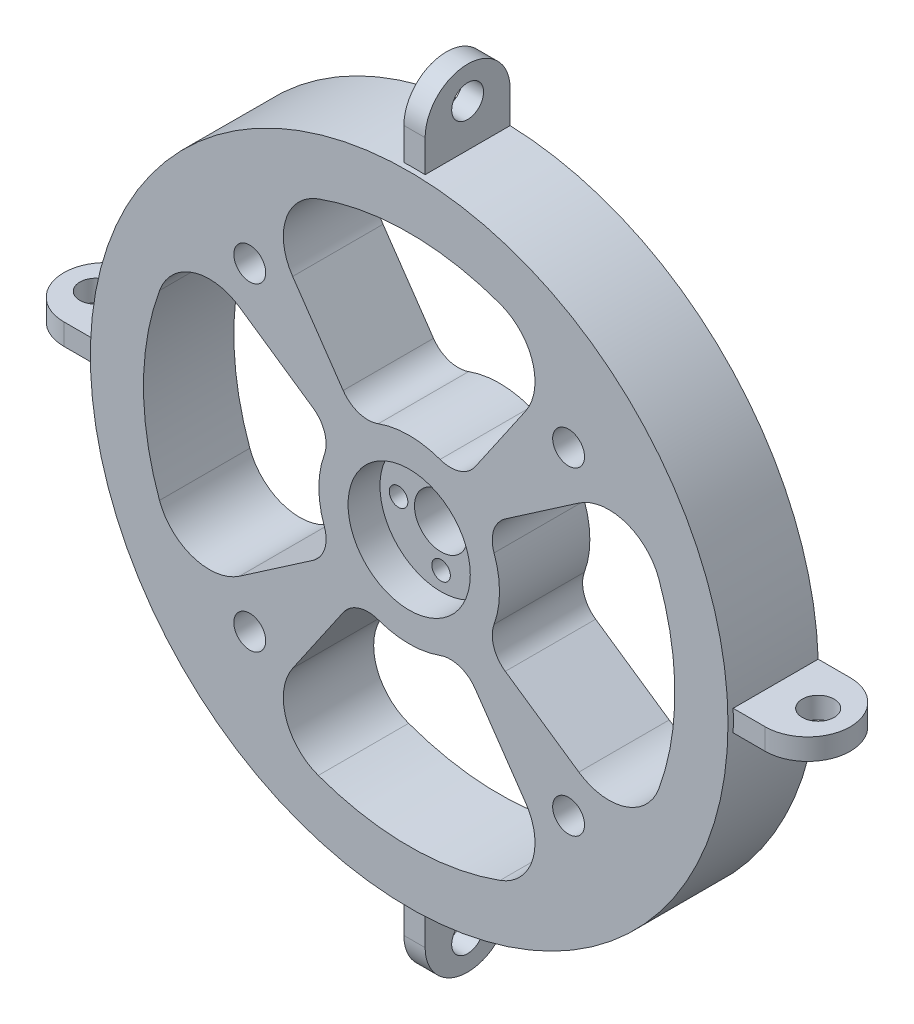
from build123d import *

# Parameters (mm, degrees)
SKETCH_1_R               = 60
EXTRUDE_1_DEPTH          = 17
SKETCH_2_R               = 3
CUT_EXTRUDE_1_DEPTH      = 87.539008545
EXTRUDE_2_DEPTH          = 2
SKETCH_4_R               = 3
CUT_EXTRUDE_7_DEPTH      = 99.025506885
CUT_EXTRUDE_3_REACH      = 98.773
SKETCH_5_R               = 5
SKETCH_6_R               = 11.5
CUT_EXTRUDE_4_DEPTH      = 6
CUT_EXTRUDE_5_REACH      = 97.901
SKETCH_7_R               = 1.75
CUT_EXTRUDE_6_REACH      = 98.773
PATTERN_CIRCULAR_3_COUNT = 4
PATTERN_CIRCULAR_4_COUNT = 4


with BuildPart() as part:
    # 草图1 → 凸台-拉伸1 (new body)
    with BuildSketch(Plane.XY):
        Circle(SKETCH_1_R)
    extrude(amount=EXTRUDE_1_DEPTH)

    # 草图2 → 切除-拉伸1 (cut, through all)
    with BuildSketch(Plane.XY.offset(17)):
        with Locations((-30, 30)):
            Circle(SKETCH_2_R)
        with Locations((30, 30)):
            Circle(SKETCH_2_R)
        with Locations((30, -30)):
            Circle(SKETCH_2_R)
        with Locations((-30, -30)):
            Circle(SKETCH_2_R)
    extrude(amount=-CUT_EXTRUDE_1_DEPTH, mode=Mode.SUBTRACT)

    # 草图3 → 凸台-拉伸2 (add, symmetric)
    with BuildSketch(Plane(origin=(0, 0, 0), x_dir=(0, 0, -1), z_dir=(1, 0, 0))):
        with BuildLine():
            Line((0, 58), (-16, 58))
            Line((-16, 58), (-16, 66))
            ThreePointArc((-16, 66), (-8, 74), (0, 66))
            Line((0, 66), (0, 58))
        make_face()
    extrude_2 = extrude(amount=EXTRUDE_2_DEPTH, both=True)

    # 草图4 → 切除-拉伸7 (cut, through all)
    with BuildSketch(Plane(origin=(2, 0, 0), x_dir=(0, 0, -1), z_dir=(1, 0, 0))):
        with Locations((-8, 67.966657402)):
            Circle(SKETCH_4_R)
    cut_extrude_7 = extrude(amount=-CUT_EXTRUDE_7_DEPTH, mode=Mode.SUBTRACT)

    # 草图5 → 切除-拉伸3 (cut, up to next)
    with BuildSketch(Plane(origin=(0, 0, 0), x_dir=(-1, 0, 0), z_dir=(0, 0, -1)), mode=Mode.PRIVATE) as cut_extrude_3_sk1:
        Circle(SKETCH_5_R)
    cut_extrude_3_tool1 = extrude(cut_extrude_3_sk1.sketch, amount=-CUT_EXTRUDE_3_REACH, mode=Mode.PRIVATE) & part.part
    add(cut_extrude_3_tool1.solids().sort_by_distance((0, 0, 0))[0], mode=Mode.SUBTRACT)

    # 草图6 → 切除-拉伸4 (cut)
    with BuildSketch(Plane.XY.offset(17)):
        Circle(SKETCH_6_R)
    extrude(amount=-CUT_EXTRUDE_4_DEPTH, mode=Mode.SUBTRACT)

    # 草图7 → 切除-拉伸5 (cut, up to next)
    with BuildSketch(Plane.XY.offset(11), mode=Mode.PRIVATE) as cut_extrude_5_sk1:
        with Locations((-8, 0)):
            Circle(SKETCH_7_R)
    cut_extrude_5_tool1 = extrude(cut_extrude_5_sk1.sketch, amount=-CUT_EXTRUDE_5_REACH, mode=Mode.PRIVATE) & part.part
    # 草图7 → 切除-拉伸5 (cut, up to next)
    with BuildSketch(Plane.XY.offset(11), mode=Mode.PRIVATE) as cut_extrude_5_sk2:
        with Locations((0, 8)):
            Circle(SKETCH_7_R)
    cut_extrude_5_tool2 = extrude(cut_extrude_5_sk2.sketch, amount=-CUT_EXTRUDE_5_REACH, mode=Mode.PRIVATE) & part.part
    # 草图7 → 切除-拉伸5 (cut, up to next)
    with BuildSketch(Plane.XY.offset(11), mode=Mode.PRIVATE) as cut_extrude_5_sk3:
        with Locations((8, 0)):
            Circle(SKETCH_7_R)
    cut_extrude_5_tool3 = extrude(cut_extrude_5_sk3.sketch, amount=-CUT_EXTRUDE_5_REACH, mode=Mode.PRIVATE) & part.part
    # 草图7 → 切除-拉伸5 (cut, up to next)
    with BuildSketch(Plane.XY.offset(11), mode=Mode.PRIVATE) as cut_extrude_5_sk4:
        with Locations((0, -8)):
            Circle(SKETCH_7_R)
    cut_extrude_5_tool4 = extrude(cut_extrude_5_sk4.sketch, amount=-CUT_EXTRUDE_5_REACH, mode=Mode.PRIVATE) & part.part
    add(cut_extrude_5_tool1.solids().sort_by_distance((-8, 0, 11))[0], mode=Mode.SUBTRACT)
    add(cut_extrude_5_tool2.solids().sort_by_distance((0, 8, 11))[0], mode=Mode.SUBTRACT)
    add(cut_extrude_5_tool3.solids().sort_by_distance((8, 0, 11))[0], mode=Mode.SUBTRACT)
    add(cut_extrude_5_tool4.solids().sort_by_distance((0, -8, 11))[0], mode=Mode.SUBTRACT)

    # 草图8 → 切除-拉伸6 (cut, up to next)
    with BuildSketch(Plane.XY.offset(17), mode=Mode.PRIVATE) as cut_extrude_6_sk1:
        with BuildLine():
            Line((-18.09189724, 12.423764363), (-31.926877482, 21.924290052))
            ThreePointArc((-31.926877482, 21.924290052), (-40.638216775, 23.204165271), (-46.984631039, 17.101007166))
            ThreePointArc((-46.984631039, 17.101007166), (-50, 0), (-46.984631039, -17.101007166))
            ThreePointArc((-46.984631039, -17.101007166), (-40.638216775, -23.204165271), (-31.926877482, -21.924290052))
            Line((-31.926877482, -21.924290052), (-18.09189724, -12.423764363))
            ThreePointArc((-18.09189724, -12.423764363), (-15.903129, -9.481080017), (-15.974774553, -5.814342437))
            ThreePointArc((-15.974774553, -5.814342437), (-17, 0), (-15.974774553, 5.814342437))
            ThreePointArc((-15.974774553, 5.814342437), (-15.903129, 9.481080017), (-18.09189724, 12.423764363))
        make_face()
    cut_extrude_6_tool1 = extrude(cut_extrude_6_sk1.sketch, amount=-CUT_EXTRUDE_6_REACH, mode=Mode.PRIVATE) & part.part
    cut_extrude_6 = cut_extrude_6_tool1.solids().sort_by_distance((-33.87223, 0, 17))[0]
    add(cut_extrude_6, mode=Mode.SUBTRACT)

    # 阵列(圆周)3: 切除-拉伸6 ×4 about axis
    pattern_circular_3_axis = Axis((0, 0, 17), (0, 0, 1))
    for i in range(1, PATTERN_CIRCULAR_3_COUNT):
        add(cut_extrude_6.rotate(pattern_circular_3_axis, i * 360 / PATTERN_CIRCULAR_3_COUNT), mode=Mode.SUBTRACT)

    # 阵列(圆周)4: 凸台-拉伸2, 切除-拉伸7 ×4 about axis
    pattern_circular_4_axis = Axis((0, 0, 17), (0, 0, 1))
    add([extrude_2.rotate(pattern_circular_4_axis, i * 360 / PATTERN_CIRCULAR_4_COUNT) for i in range(1, PATTERN_CIRCULAR_4_COUNT)])
    add([cut_extrude_7.rotate(pattern_circular_4_axis, i * 360 / PATTERN_CIRCULAR_4_COUNT) for i in range(1, PATTERN_CIRCULAR_4_COUNT)], mode=Mode.SUBTRACT)


solid = part.part
